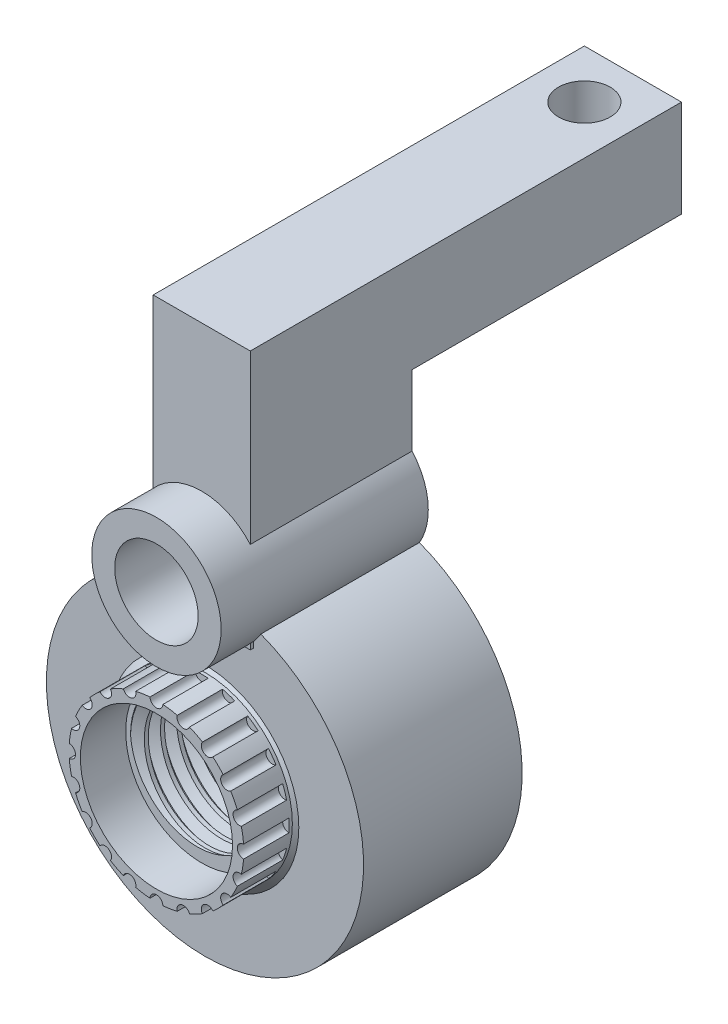
from build123d import *
from build123d.topology import SkipClean

# Parameters (mm, degrees)
CROQUIS1_R                    = 13.5
SALIENTE_EXTRUIR1_DEPTH       = 25
TALADRO_DE_MARGEN_PARA_M201_D = 22
CROQUIS4_R                    = 19.5
CROQUIS4_R_2                  = 13.5
SALIENTE_EXTRUIR2_DEPTH       = 10
CHAFL_N1_SIZE                 = 7
CHAFL_N2_SIZE                 = 7.50658097
CHAFL_N2_SIZE_2               = 7
REDONDEO1_R                   = 3
REDONDEO2_R                   = 3
CROQUIS5_2_R                  = 11.755339258
SALIENTE_EXTRUIR4_DEPTH       = 7
CROQUIS5_R                    = 11.755339258
SALIENTE_EXTRUIR3_DEPTH       = 7
SALIENTE_EXTRUIR5_DEPTH       = 7.5
SALIENTE_EXTRUIR5_DEPTH_BACK  = 7.5
CROQUIS8_R                    = 4
CORTAR_EXTRUIR1_DEPTH         = 15
ROSCA1_PITCH                  = 2.5
ROSCA1_FROM                   = 5
ROSCA1_TO                     = 30
SALIENTE_EXTRUIR6_DEPTH       = 25
CROQUIS10_R                   = 10
SALIENTE_EXTRUIR7_DEPTH       = 7.5
CROQUIS11_R                   = 6.45
CORTAR_EXTRUIR2_DEPTH         = 20
CROQUIS12_R                   = 16.5
CROQUIS12_R_2                 = 14.5
SALIENTE_EXTRUIR8_DEPTH       = 3
REDONDEO3_R                   = 5


with BuildPart() as part:
    # Croquis1 → Saliente-Extruir1 (new body)
    with BuildSketch(Plane.XY):
        Circle(CROQUIS1_R)
    extrude(amount=SALIENTE_EXTRUIR1_DEPTH)

    # Taladro de margen para M201 (through all)
    with Locations(Plane.XY.offset(25)):
        with Locations((0, 0)):
            Hole(TALADRO_DE_MARGEN_PARA_M201_D / 2)

    # Croquis4 → Saliente-Extruir2 (add)
    with BuildSketch(Plane(origin=(0, 0, 7.5), x_dir=(-1, 0, 0), z_dir=(0, 0, -1))):
        Circle(CROQUIS4_R)
        Circle(CROQUIS4_R_2, mode=Mode.SUBTRACT)
    extrude(amount=-SALIENTE_EXTRUIR2_DEPTH)

    # Chaflán1
    # the kernel refuses this chamfer: 7 mm, written as the material it adds along each edge
    with BuildSketch(Plane(origin=(0, 0, 17.5), x_dir=(1, 0, 0), z_dir=(0, 1, 0))) as chafl_n1_piece_1_section:
        Polygon((13.5 + CHAFL_N1_SIZE, 0), (13.5, -CHAFL_N1_SIZE), (13.5, 0), align=None)
    chafl_n1_piece_1 = revolve(axis=Axis((0, 0, 17.5), (0, 0, -1)), mode=Mode.PRIVATE)
    chafl_n1_piece_1 = chafl_n1_piece_1 & Plane(origin=(0, 0, 17.5), x_dir=(-1, 0, 0), z_dir=(0, 0, -1)) * Cylinder(19.5, 82, mode=Mode.PRIVATE)
    add(chafl_n1_piece_1)

    # Chaflán2
    # the kernel refuses this chamfer: 7.50658097, 7 mm, written as the material it adds along each edge
    with BuildSketch(Plane(origin=(0, 0, 7.5), x_dir=(1, 0, 0), z_dir=(0, 1, 0))) as chafl_n2_piece_1_section:
        Polygon((13.5, CHAFL_N2_SIZE), (13.5 + CHAFL_N2_SIZE_2, 0), (13.5, 0), align=None)
    chafl_n2_piece_1 = revolve(axis=Axis((0, 0, 7.5), (0, 0, -1)), mode=Mode.PRIVATE)
    chafl_n2_piece_1 = split(chafl_n2_piece_1, bisect_by=Plane(origin=(0, 0, 0), z_dir=(0, 0, 1)), keep=Keep.TOP, mode=Mode.PRIVATE)
    chafl_n2_piece_1 = chafl_n2_piece_1 & Plane(origin=(0, 0, 7.5), x_dir=(-1, 0, 0), z_dir=(0, 0, -1)) * Cylinder(19.5, 82, mode=Mode.PRIVATE)
    add(chafl_n2_piece_1)

    # Redondeo1
    redondeo1_edges = [part.edges().sort_by_distance(p)[0] for p in [
        (0, 19.5, 18.5),
    ]]
    fillet(redondeo1_edges, radius=REDONDEO1_R)

    # Redondeo2
    redondeo2_edges = [part.edges().sort_by_distance(p)[0] for p in [
        (0, 19.5, 6.42763129),
    ]]
    fillet(redondeo2_edges, radius=REDONDEO2_R)

    # Croquis5<2> → Saliente-Extruir4 (add)
    with BuildSketch(Plane.XY.offset(25)):
        with BuildLine():
            ThreePointArc((13.462962963, 0.999313894), (13.333792598, 2.111865278), (13.11284363, 3.20988036))
            ThreePointArc((13.11284363, 3.20988036), (11.888206454, 3.86271243), (12.495233679, 5.110688341))
            ThreePointArc((12.495233679, 5.110688341), (12.028588077, 6.128871746), (11.479147801, 7.104869159))
            ThreePointArc((11.479147801, 7.104869159), (10.11271243, 7.347315654), (10.304383863, 8.721793004))
            ThreePointArc((10.304383863, 8.721793004), (9.545941546, 9.545941546), (8.721793004, 10.304383863))
            ThreePointArc((8.721793004, 10.304383863), (7.347315654, 10.11271243), (7.104869159, 11.479147801))
            ThreePointArc((7.104869159, 11.479147801), (6.128871746, 12.028588077), (5.110688341, 12.495233679))
            ThreePointArc((5.110688341, 12.495233679), (3.86271243, 11.888206454), (3.20988036, 13.11284363))
            ThreePointArc((3.20988036, 13.11284363), (2.111865278, 13.333792598), (0.999313894, 13.462962963))
            ThreePointArc((0.999313894, 13.462962963), (0, 12.5), (-0.999313894, 13.462962963))
            ThreePointArc((-0.999313894, 13.462962963), (-2.111865278, 13.333792598), (-3.20988036, 13.11284363))
            ThreePointArc((-3.20988036, 13.11284363), (-3.86271243, 11.888206454), (-5.110688341, 12.495233679))
            ThreePointArc((-5.110688341, 12.495233679), (-6.128871746, 12.028588077), (-7.104869159, 11.479147801))
            ThreePointArc((-7.104869159, 11.479147801), (-7.347315654, 10.11271243), (-8.721793004, 10.304383863))
            ThreePointArc((-8.721793004, 10.304383863), (-9.545941546, 9.545941546), (-10.304383863, 8.721793004))
            ThreePointArc((-10.304383863, 8.721793004), (-10.11271243, 7.347315654), (-11.479147801, 7.104869159))
            ThreePointArc((-11.479147801, 7.104869159), (-12.028588077, 6.128871746), (-12.495233679, 5.110688341))
            ThreePointArc((-12.495233679, 5.110688341), (-11.888206454, 3.86271243), (-13.11284363, 3.20988036))
            ThreePointArc((-13.11284363, 3.20988036), (-13.333792598, 2.111865278), (-13.462962963, 0.999313894))
            ThreePointArc((-13.462962963, 0.999313894), (-12.5, 0), (-13.462962963, -0.999313894))
            ThreePointArc((-13.462962963, -0.999313894), (-13.333792598, -2.111865278), (-13.11284363, -3.20988036))
            ThreePointArc((-13.11284363, -3.20988036), (-11.888206454, -3.86271243), (-12.495233679, -5.110688341))
            ThreePointArc((-12.495233679, -5.110688341), (-12.028588077, -6.128871746), (-11.479147801, -7.104869159))
            ThreePointArc((-11.479147801, -7.104869159), (-10.11271243, -7.347315654), (-10.304383863, -8.721793004))
            ThreePointArc((-10.304383863, -8.721793004), (-9.545941546, -9.545941546), (-8.721793004, -10.304383863))
            ThreePointArc((-8.721793004, -10.304383863), (-7.347315654, -10.11271243), (-7.104869159, -11.479147801))
            ThreePointArc((-7.104869159, -11.479147801), (-6.128871746, -12.028588077), (-5.110688341, -12.495233679))
            ThreePointArc((-5.110688341, -12.495233679), (-3.86271243, -11.888206454), (-3.20988036, -13.11284363))
            ThreePointArc((-3.20988036, -13.11284363), (-2.111865278, -13.333792598), (-0.999313894, -13.462962963))
            ThreePointArc((-0.999313894, -13.462962963), (0, -12.5), (0.999313894, -13.462962963))
            ThreePointArc((0.999313894, -13.462962963), (2.111865278, -13.333792598), (3.20988036, -13.11284363))
            ThreePointArc((3.20988036, -13.11284363), (3.86271243, -11.888206454), (5.110688341, -12.495233679))
            ThreePointArc((5.110688341, -12.495233679), (6.128871746, -12.028588077), (7.104869159, -11.479147801))
            ThreePointArc((7.104869159, -11.479147801), (7.347315654, -10.11271243), (8.721793004, -10.304383863))
            ThreePointArc((8.721793004, -10.304383863), (9.545941546, -9.545941546), (10.304383863, -8.721793004))
            ThreePointArc((10.304383863, -8.721793004), (10.11271243, -7.347315654), (11.479147801, -7.104869159))
            ThreePointArc((11.479147801, -7.104869159), (12.028588077, -6.128871746), (12.495233679, -5.110688341))
            ThreePointArc((12.495233679, -5.110688341), (11.888206454, -3.86271243), (13.11284363, -3.20988036))
            ThreePointArc((13.11284363, -3.20988036), (13.333792598, -2.111865278), (13.462962963, -0.999313894))
            ThreePointArc((13.462962963, -0.999313894), (12.5, 0), (13.462962963, 0.999313894))
        make_face()
        Circle(CROQUIS5_2_R, mode=Mode.SUBTRACT)
    extrude(amount=SALIENTE_EXTRUIR4_DEPTH)

    # Croquis5 → Saliente-Extruir3 (add)
    with BuildSketch(Plane.XY.offset(25)):
        with BuildLine():
            ThreePointArc((13.462962963, 0.999313894), (13.333792598, 2.111865278), (13.11284363, 3.20988036))
            ThreePointArc((13.11284363, 3.20988036), (11.888206454, 3.86271243), (12.495233679, 5.110688341))
            ThreePointArc((12.495233679, 5.110688341), (12.028588077, 6.128871746), (11.479147801, 7.104869159))
            ThreePointArc((11.479147801, 7.104869159), (10.11271243, 7.347315654), (10.304383863, 8.721793004))
            ThreePointArc((10.304383863, 8.721793004), (9.545941546, 9.545941546), (8.721793004, 10.304383863))
            ThreePointArc((8.721793004, 10.304383863), (7.347315654, 10.11271243), (7.104869159, 11.479147801))
            ThreePointArc((7.104869159, 11.479147801), (6.128871746, 12.028588077), (5.110688341, 12.495233679))
            ThreePointArc((5.110688341, 12.495233679), (3.86271243, 11.888206454), (3.20988036, 13.11284363))
            ThreePointArc((3.20988036, 13.11284363), (2.111865278, 13.333792598), (0.999313894, 13.462962963))
            ThreePointArc((0.999313894, 13.462962963), (0, 12.5), (-0.999313894, 13.462962963))
            ThreePointArc((-0.999313894, 13.462962963), (-2.111865278, 13.333792598), (-3.20988036, 13.11284363))
            ThreePointArc((-3.20988036, 13.11284363), (-3.86271243, 11.888206454), (-5.110688341, 12.495233679))
            ThreePointArc((-5.110688341, 12.495233679), (-6.128871746, 12.028588077), (-7.104869159, 11.479147801))
            ThreePointArc((-7.104869159, 11.479147801), (-7.347315654, 10.11271243), (-8.721793004, 10.304383863))
            ThreePointArc((-8.721793004, 10.304383863), (-9.545941546, 9.545941546), (-10.304383863, 8.721793004))
            ThreePointArc((-10.304383863, 8.721793004), (-10.11271243, 7.347315654), (-11.479147801, 7.104869159))
            ThreePointArc((-11.479147801, 7.104869159), (-12.028588077, 6.128871746), (-12.495233679, 5.110688341))
            ThreePointArc((-12.495233679, 5.110688341), (-11.888206454, 3.86271243), (-13.11284363, 3.20988036))
            ThreePointArc((-13.11284363, 3.20988036), (-13.333792598, 2.111865278), (-13.462962963, 0.999313894))
            ThreePointArc((-13.462962963, 0.999313894), (-12.5, 0), (-13.462962963, -0.999313894))
            ThreePointArc((-13.462962963, -0.999313894), (-13.333792598, -2.111865278), (-13.11284363, -3.20988036))
            ThreePointArc((-13.11284363, -3.20988036), (-11.888206454, -3.86271243), (-12.495233679, -5.110688341))
            ThreePointArc((-12.495233679, -5.110688341), (-12.028588077, -6.128871746), (-11.479147801, -7.104869159))
            ThreePointArc((-11.479147801, -7.104869159), (-10.11271243, -7.347315654), (-10.304383863, -8.721793004))
            ThreePointArc((-10.304383863, -8.721793004), (-9.545941546, -9.545941546), (-8.721793004, -10.304383863))
            ThreePointArc((-8.721793004, -10.304383863), (-7.347315654, -10.11271243), (-7.104869159, -11.479147801))
            ThreePointArc((-7.104869159, -11.479147801), (-6.128871746, -12.028588077), (-5.110688341, -12.495233679))
            ThreePointArc((-5.110688341, -12.495233679), (-3.86271243, -11.888206454), (-3.20988036, -13.11284363))
            ThreePointArc((-3.20988036, -13.11284363), (-2.111865278, -13.333792598), (-0.999313894, -13.462962963))
            ThreePointArc((-0.999313894, -13.462962963), (0, -12.5), (0.999313894, -13.462962963))
            ThreePointArc((0.999313894, -13.462962963), (2.111865278, -13.333792598), (3.20988036, -13.11284363))
            ThreePointArc((3.20988036, -13.11284363), (3.86271243, -11.888206454), (5.110688341, -12.495233679))
            ThreePointArc((5.110688341, -12.495233679), (6.128871746, -12.028588077), (7.104869159, -11.479147801))
            ThreePointArc((7.104869159, -11.479147801), (7.347315654, -10.11271243), (8.721793004, -10.304383863))
            ThreePointArc((8.721793004, -10.304383863), (9.545941546, -9.545941546), (10.304383863, -8.721793004))
            ThreePointArc((10.304383863, -8.721793004), (10.11271243, -7.347315654), (11.479147801, -7.104869159))
            ThreePointArc((11.479147801, -7.104869159), (12.028588077, -6.128871746), (12.495233679, -5.110688341))
            ThreePointArc((12.495233679, -5.110688341), (11.888206454, -3.86271243), (13.11284363, -3.20988036))
            ThreePointArc((13.11284363, -3.20988036), (13.333792598, -2.111865278), (13.462962963, -0.999313894))
            ThreePointArc((13.462962963, -0.999313894), (12.5, 0), (13.462962963, 0.999313894))
        make_face()
        Circle(CROQUIS5_R, mode=Mode.SUBTRACT)
    extrude(amount=SALIENTE_EXTRUIR3_DEPTH)

    # Rosca1: arcs per turn and ends read off the stored shape
    # Rosca1: the profile of Perfil de rosca1 profile screwed along a right-hand helix through 14 turns, 10 arcs to a turn; built about Z, then put on its axis
    rosca1_z = Axis((0, 0, 0), (0, 0, 1))
    rosca1_corners = [(11.0003, 0, -0.000173205), (11.0003, 0, 2.187673198), (9.646835312, 0, 1.406249997), (9.646835312, 0, 0.781249997)]
    with BuildLine(mode=Mode.PRIVATE) as rosca1_profile:
        Line(rosca1_corners[0], rosca1_corners[1])
        Line(rosca1_corners[1], rosca1_corners[2])
        Line(rosca1_corners[2], rosca1_corners[3])
        Line(rosca1_corners[3], rosca1_corners[0])
    rosca1_cap = Face(rosca1_profile.wire())
    rosca1_turn_angles = [0, 18, 36, 54, 72, 90, 108, 126, 144, 162, 180, 198, 216, 234, 252, 270, 288, 306, 324, 342, 360]
    rosca1_turn_weights = [1, 0.9510565162951535, 1, 0.9510565162951535, 1, 0.9510565162951535, 1, 0.9510565162951535, 1, 0.9510565162951535, 1, 0.9510565162951535, 1, 0.9510565162951535, 1, 0.9510565162951535, 1, 0.9510565162951535, 1, 0.9510565162951535, 1]
    rosca1_turn_rails = [Edge.make_bspline([Vector(p[0], p[1], 0).rotate(rosca1_z, rosca1_turn_angles[k]) / rosca1_turn_weights[k] + Vector(0, 0, p[2] + ROSCA1_PITCH * rosca1_turn_angles[k] / 360) for k in range(21)], [0, 0, 0, 1, 1, 2, 2, 3, 3, 4, 4, 5, 5, 6, 6, 7, 7, 8, 8, 9, 9, 10, 10, 10], 2, rosca1_turn_weights) for p in rosca1_corners]
    rosca1_turn_sides = [Face.make_surface_from_curves(rosca1_turn_rails[p[0]], rosca1_turn_rails[p[1]]) for p in [(0, 1), (1, 2), (2, 3), (3, 0)]]
    rosca1 = Plane(origin=(0, 0, 30), x_dir=(-1, 0, 0), z_dir=(0, 0, -1)) * split(split(Solid(Shell([*[p.moved(Location((0, 0, ROSCA1_PITCH * i))) for i in range(14) for p in rosca1_turn_sides], rosca1_cap, rosca1_cap.rotate(rosca1_z, 5040).moved(Location((0, 0, ROSCA1_PITCH * 5040 / 360)))])), bisect_by=Plane.XY.offset(ROSCA1_FROM), keep=Keep.TOP, mode=Mode.PRIVATE), bisect_by=Plane.XY.offset(ROSCA1_TO), keep=Keep.BOTTOM, mode=Mode.PRIVATE)
    add(rosca1)


with BuildPart() as body_2:
    # Croquis6<2> → Revolución2 (revolve)
    with BuildSketch(Plane(origin=(0, 0, 0), x_dir=(0, 0, -1), z_dir=(1, 0, 0)), mode=Mode.PRIVATE) as revoluci_n2_sk:
        with BuildLine():
            Line((0, 14.5), (0, 24.5))
            Line((0, 24.5), (-24.5, 24.5))
            Line((-24.5, 24.5), (-24.5, 14.5))
            Line((-24.5, 14.5), (-19.878679656, 19.121320344))
            ThreePointArc((-19.878679656, 19.121320344), (-18.90540961, 19.771638598), (-17.757359313, 20))
            Line((-17.757359313, 20), (-7.079759332, 20))
            ThreePointArc((-7.079759332, 20), (-5.980255652, 19.791252704), (-5.033764252, 19.194061105))
            Line((-5.033764252, 19.194061105), (0, 14.5))
        make_face()
    revolve(revoluci_n2_sk.sketch.rotate(Axis((0, 0, 0), (0, 0, 1)), 90), axis=Axis((0, 0, 0), (0, 0, 1)))

    # Croquis7 → Saliente-Extruir5 (add, two sides: drawn at the far end of the back side and taken through both)
    with BuildSketch(Plane(origin=(0, 0, 0), x_dir=(0, 0, -1), z_dir=(1, 0, 0)).offset(-SALIENTE_EXTRUIR5_DEPTH_BACK)):
        Polygon((-25, 20.5), (0, 20.5), (0, 45.5), (41.610883423, 45.5), (41.610883423, 60.5), (0, 60.5), (-25, 60.5), align=None)
    extrude(amount=SALIENTE_EXTRUIR5_DEPTH + SALIENTE_EXTRUIR5_DEPTH_BACK)

    # Croquis8 → Cortar-Extruir1 (cut)
    with BuildSketch(Plane(origin=(0, 60.5, 0), x_dir=(1, 0, 0), z_dir=(0, 1, 0))):
        with Locations(Location((0, 34.110883423, 0), (0, 0, 270))):
            Circle(CROQUIS8_R)
    extrude(amount=-CORTAR_EXTRUIR1_DEPTH, mode=Mode.SUBTRACT)



with BuildPart() as body_3:
    # Croquis6 → Revolución1 (revolve)
    with BuildSketch(Plane(origin=(0, 0, 0), x_dir=(0, 0, -1), z_dir=(1, 0, 0)), mode=Mode.PRIVATE) as revoluci_n1_sk:
        with BuildLine():
            Line((0, 14.5), (0, 24.5))
            Line((0, 24.5), (-24.5, 24.5))
            Line((-24.5, 24.5), (-24.5, 14.5))
            Line((-24.5, 14.5), (-19.878679656, 19.121320344))
            ThreePointArc((-19.878679656, 19.121320344), (-18.90540961, 19.771638598), (-17.757359313, 20))
            Line((-17.757359313, 20), (-7.079759332, 20))
            ThreePointArc((-7.079759332, 20), (-5.980255652, 19.791252704), (-5.033764252, 19.194061105))
            Line((-5.033764252, 19.194061105), (0, 14.5))
        make_face()
    revolve(revoluci_n1_sk.sketch.rotate(Axis((0, 0, 0), (0, 0, 1)), 90), axis=Axis((0, 0, 0), (0, 0, 1)))


with BuildPart() as body_2_1:
    add(body_2.part)

    add(body_3.part)  # Saliente-Extruir6 merges body 3
    # Croquis9 → Saliente-Extruir6 (add)
    with BuildSketch(Plane.XY.offset(25)):
        with BuildLine():
            Line((7.5, 34.614378278), (7.5, 23.323807579))
            ThreePointArc((7.5, 23.323807579), (8.062990406, 23.135215273), (8.621245439, 22.933035714))
            ThreePointArc((8.621245439, 22.933035714), (9.954249326, 28.955468654), (7.5, 34.614378278))
        make_face()
        with BuildLine():
            Line((-7.5, 34.614378278), (-7.5, 23.323807579))
            ThreePointArc((-7.5, 23.323807579), (-8.062990406, 23.135215273), (-8.621245439, 22.933035714))
            ThreePointArc((-8.621245439, 22.933035714), (-9.954249326, 28.955468654), (-7.5, 34.614378278))
        make_face()
    extrude(amount=-SALIENTE_EXTRUIR6_DEPTH)

    # Croquis10 → Saliente-Extruir7 (add)
    with SkipClean():  # the faces are left unmerged after this step: merging them gives an invalid solid
        with BuildSketch(Plane.XY.offset(24.5)):
            with Locations((0, 28)):
                Circle(CROQUIS10_R)
        extrude(amount=SALIENTE_EXTRUIR7_DEPTH)
    add(body_2_1.part.scale(1), mode=Mode.REPLACE)  # the faces are merged on a copy

    # Croquis11 → Cortar-Extruir2 (cut)
    with BuildSketch(Plane.XY.offset(32)):
        with Locations((0, 28)):
            Circle(CROQUIS11_R)
    extrude(amount=-CORTAR_EXTRUIR2_DEPTH, mode=Mode.SUBTRACT)

    # Croquis12 → Saliente-Extruir8 (add)
    with BuildSketch(Plane(origin=(0, 0, 0), x_dir=(-1, 0, 0), z_dir=(0, 0, -1))):
        Circle(CROQUIS12_R)
        Circle(CROQUIS12_R_2, mode=Mode.SUBTRACT)
    extrude(amount=SALIENTE_EXTRUIR8_DEPTH)

    # Redondeo3
    # the kernel refuses this fillet: 5 mm, written as the material it adds along each edge
    with BuildSketch(Plane(origin=(0, 0, 0), x_dir=(-1, 0, 0), z_dir=(0, -1, 0))) as redondeo3_piece_1:
        with BuildLine():
            CenterArc((21.082575695, 5), REDONDEO3_R, 203.578178478, 66.421821522)
            Line((16.5, 3), (16.408348486, 2.96))
            ThreePointArc((16.408348486, 2.96), (16.4, 1.5), (16.4, 0))
            Line((16.4, 0), (16.5, -0.1))
            Line((16.5, -0.1), (21.082575695, -0.1))
            Line((21.082575695, -0.1), (21.082575695, 0))
        make_face()
    revolve(axis=Axis((0, 0, 0), (0, 0, -1)))


solid = Compound([part.part, body_2_1.part])
